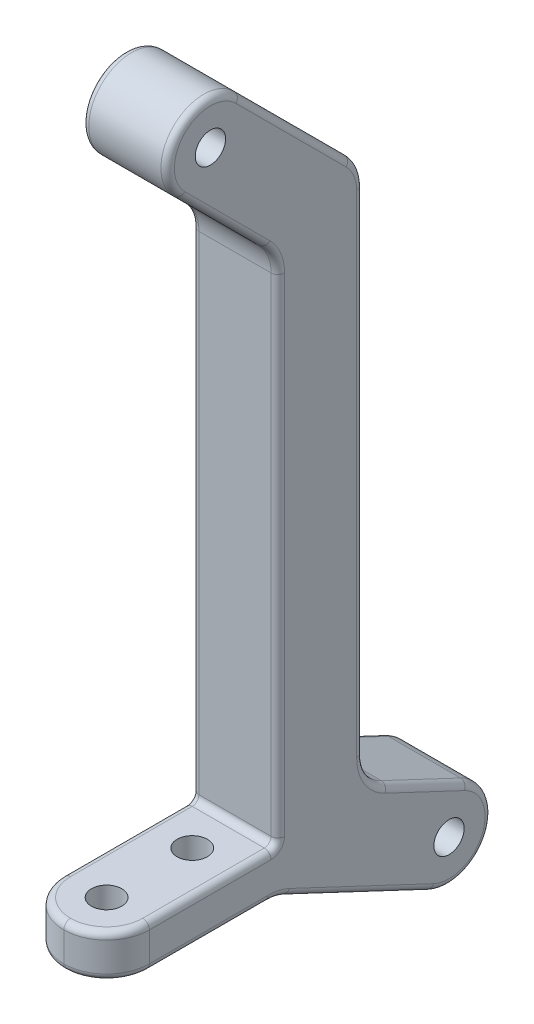
from build123d import *

# Parameters (mm, degrees)
SKETCH1_R           = 2.25
BOSS_EXTRUDE1_DEPTH = 12.7
FILLET1_R           = 6.35
FILLET3_R           = 6.35
FILLET4_R           = 1
CUT_EXTRUDE1_REACH  = 121.755
SKETCH2_R           = 2.25


with BuildPart() as part:
    # Sketch1 → Boss-Extrude1 (new body)
    with BuildSketch(Plane(origin=(0, 0, 0), x_dir=(0, 0, -1), z_dir=(1, 0, 0))):
        with BuildLine():
            Line((-25.4, 87.319743879), (-25.4, 11.3))
            Line((-25.4, 11.3), (-50.8, 11.3))
            Line((-50.8, 11.3), (-50.8, 4.95))
            Line((-50.8, 4.95), (-25.4, 4.95))
            Line((-25.4, 4.95), (-2.706927177, -5.744131375))
            ThreePointArc((-2.706927177, -5.744131375), (5.744131375, -2.706927177), (2.706927177, 5.744131375))
            Line((2.706927177, 5.744131375), (-12.7, 13.004659934))
            Line((-12.7, 13.004659934), (-12.7, 92.580256121))
            Line((-12.7, 92.580256121), (-30.909871939, 110.790128061))
            ThreePointArc((-30.909871939, 110.790128061), (-39.890128061, 110.790128061), (-39.890128061, 101.809871939))
            Line((-39.890128061, 101.809871939), (-25.4, 87.319743879))
        make_face()
        with Locations((-35.4, 106.3)):
            Circle(SKETCH1_R, mode=Mode.SUBTRACT)
        Circle(SKETCH1_R, mode=Mode.SUBTRACT)
    extrude(amount=BOSS_EXTRUDE1_DEPTH)

    # Fillet1
    fillet1_edges = [part.edges().sort_by_distance(p)[0] for p in [
        (6.35, 4.95, 25.4),
        (6.35, 87.319743879, 25.4),
        (6.35, 92.580256121, 12.7),
        (6.35, 13.004659934, 12.7),
    ]]
    fillet(fillet1_edges, radius=FILLET1_R)

    # Fillet3
    fillet3_edges = [part.edges().sort_by_distance(p)[0] for p in [
        (0, 8.125, 50.8),
        (12.7, 8.125, 50.8),
    ]]
    fillet(fillet3_edges, radius=FILLET3_R - 0.0001)  # a hair under: the kernel refuses the full size

    # Fillet4
    fillet4_edges = [part.edges().sort_by_distance(p)[0] for p in [
        (12.7, -2.706927177, -5.744131375),
        (0, 11.3, 34.92505),
        (0, 47.994743879, 25.4),
        (0, 110.790128061, 39.890128061),
        (0, 102.615128061, 22.734871939),
        (0, -2.706927177, -5.744131375),
        (6.35, 11.3, 25.4),
        (12.7, 102.615128061, 22.734871939),
        (12.7, 110.790128061, 39.890128061),
        (0, -0.7, 13.410633407),
        (12.7, -0.7, 13.410633407),
        (12.7, 47.994743879, 25.4),
        (0, 53.490994951, 12.7),
        (12.7, 53.490994951, 12.7),
        (0, 8.515994951, 3.175),
        (12.7, 8.515994951, 3.175),
        (12.7, 11.3, 34.92505),
        (0, 95.494743879, 33.575),
        (0, 92.380039796, 13.183364969),
        (12.7, 95.494743879, 33.575),
        (12.7, 92.380039796, 13.183364969),
        (0, 4.796681944, 25.434315884),
        (12.7, 4.796681944, 25.434315884),
        (0, 13.630996486, 11.712438232),
        (12.7, 13.630996486, 11.712438232),
        (0, 87.119527553, 25.883364969),
        (12.7, 87.119527553, 25.883364969),
        (0, 4.95, 35.635683407),
        (12.7, 4.95, 35.635683407),
        (10.84015735, 4.95, 48.94015735),
        (1.85984265, 4.95, 48.94015735),
        (10.84015735, 11.3, 48.94015735),
        (1.85984265, 11.3, 48.94015735),
    ]]
    fillet(fillet4_edges, radius=FILLET4_R)

    # Sketch2 → Cut-Extrude1 (cut, up to next)
    with BuildSketch(Plane.XZ.offset(-4.95), mode=Mode.PRIVATE) as cut_extrude1_sk1:
        with Locations(Location((6.35, 31.75, 0), (0, 0, 270))):
            Circle(SKETCH2_R)
    cut_extrude1_tool1 = extrude(cut_extrude1_sk1.sketch, amount=-CUT_EXTRUDE1_REACH, mode=Mode.PRIVATE) & part.part
    # Sketch2 → Cut-Extrude1 (cut, up to next)
    with BuildSketch(Plane.XZ.offset(-4.95), mode=Mode.PRIVATE) as cut_extrude1_sk2:
        with Locations(Location((6.35, 44.45, 0), (0, 0, 270))):
            Circle(SKETCH2_R)
    cut_extrude1_tool2 = extrude(cut_extrude1_sk2.sketch, amount=-CUT_EXTRUDE1_REACH, mode=Mode.PRIVATE) & part.part
    add(cut_extrude1_tool1.solids().sort_by_distance((6.35, 4.95, 31.75))[0], mode=Mode.SUBTRACT)
    add(cut_extrude1_tool2.solids().sort_by_distance((6.35, 4.95, 44.45))[0], mode=Mode.SUBTRACT)


solid = part.part
